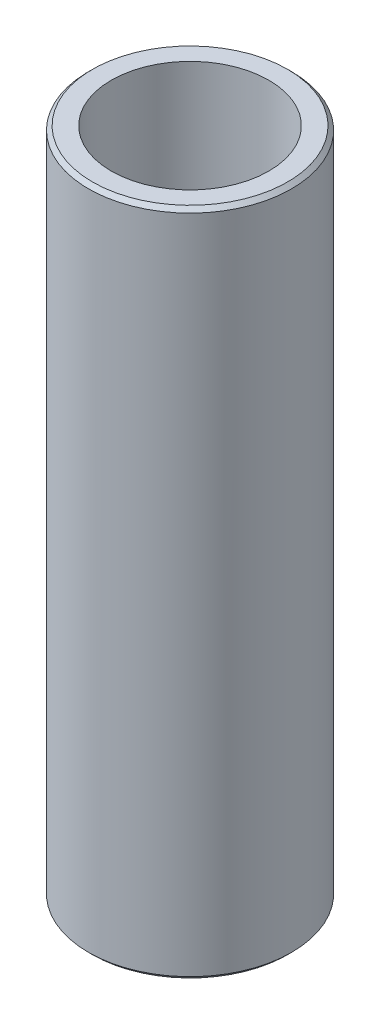
from build123d import *

# Parameters (mm, degrees)
SKETCH1_R           = 57.5
BOSS_EXTRUDE1_DEPTH = 378.887556558
SKETCH2_R           = 44.600603462
CUT_EXTRUDE1_DEPTH  = 388.515522934
CHAMFER1_SIZE       = 2.251679107


with BuildPart() as part:
    # Sketch1 → Boss-Extrude1 (new body)
    with BuildSketch(Plane(origin=(0, 0, 0), x_dir=(1, 0, 0), z_dir=(0, 1, 0))):
        Circle(SKETCH1_R)
    extrude(amount=BOSS_EXTRUDE1_DEPTH)

    # Sketch2 → Cut-Extrude1 (cut, through all)
    with BuildSketch(Plane(origin=(0, 0, 0), x_dir=(1, 0, 0), z_dir=(0, 1, 0))):
        Circle(SKETCH2_R)
    extrude(amount=CUT_EXTRUDE1_DEPTH, mode=Mode.SUBTRACT)

    # Chamfer1
    chamfer1_edges = [part.edges().sort_by_distance(p)[0] for p in [
        (-57.5, 378.887556558, 0),
        (-57.5, 0, 0),
    ]]
    chamfer(chamfer1_edges, length=CHAMFER1_SIZE)


solid = part.part
